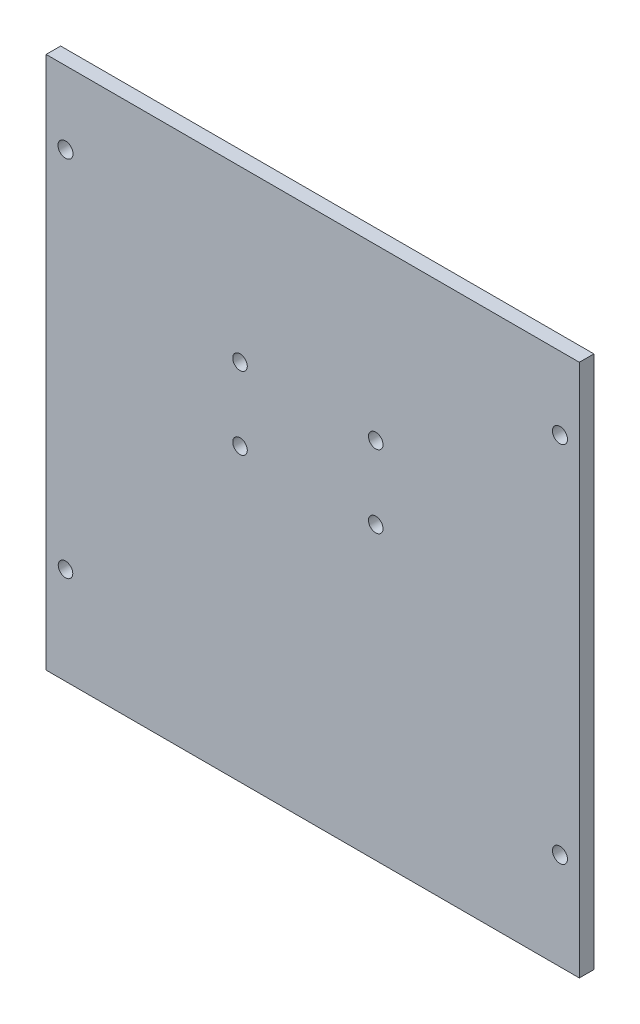
from build123d import *

# Parameters (mm, degrees)
SKETCH_1_W          = 110
SKETCH_1_H          = 110
EXTRUDE_1_DEPTH     = 3
SKETCH_2_R          = 1.5
CUT_EXTRUDE_1_DEPTH = 10
SKETCH_3_R          = 1.55
SKETCH_3_R_2        = 1.5
CUT_EXTRUDE_2_DEPTH = 10


with BuildPart() as part:
    # 草图1 → 凸台-拉伸1 (new body)
    with BuildSketch(Plane.XY):
        Rectangle(SKETCH_1_W, SKETCH_1_H)
    extrude(amount=EXTRUDE_1_DEPTH)

    # 草图2 → 切除-拉伸1 (cut)
    with BuildSketch(Plane(origin=(0, 0, 0), x_dir=(-1, 0, 0), z_dir=(0, 0, -1))):
        with Locations((-13, 5.02)):
            Circle(SKETCH_2_R)
        with Locations((-13, 20.02)):
            Circle(SKETCH_2_R)
        with Locations((15, 5.02)):
            Circle(SKETCH_2_R)
        with Locations((15, 20.02)):
            Circle(SKETCH_2_R)
    extrude(amount=-CUT_EXTRUDE_1_DEPTH, mode=Mode.SUBTRACT)

    # 草图3 → 切除-拉伸2 (cut)
    with BuildSketch(Plane(origin=(0, 0, 0), x_dir=(-1, 0, 0), z_dir=(0, 0, -1))):
        with Locations((-51, -35)):
            Circle(SKETCH_3_R)
        with Locations((-51, 40)):
            Circle(SKETCH_3_R)
        with Locations((51, -35)):
            Circle(SKETCH_3_R_2)
        with Locations((51, 40)):
            Circle(SKETCH_3_R)
    extrude(amount=-CUT_EXTRUDE_2_DEPTH, mode=Mode.SUBTRACT)


solid = part.part
